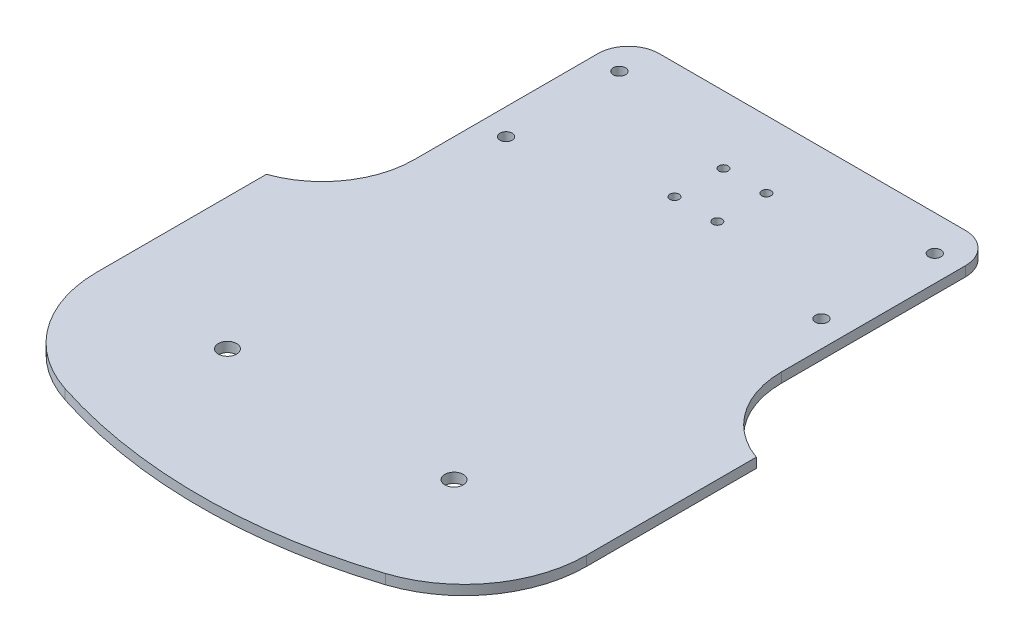
from build123d import *

# Parameters (mm, degrees)
P_IDAT_VYSUNUT_M1_DEPTH  = 0.8
SKICA2_R                 = 1
ODEBRAT_VYSUNUT_M1_DEPTH = 94.955095657
SKICA3_R                 = 0.75
ODEBRAT_VYSUNUT_M2_DEPTH = 94.955095657
SKICA8_R                 = 1.5
ODEBRAT_VYSUNUT_M4_DEPTH = 94.955095657


with BuildPart() as part:
    # Skica1 → Přidat vysunutím1 (new, symmetric)
    with BuildSketch(Plane(origin=(0, 0, 0), x_dir=(1, 0, 0), z_dir=(0, 1, 0))):
        with BuildLine():
            Line((-25, 15), (25, 15))
            ThreePointArc((25, 15), (28.535533906, 13.535533906), (30, 10))
            Line((30, 10), (30, -20))
            ThreePointArc((30, -20), (32.752551286, -28.660254038), (40, -34.142135624))
            Line((40, -34.142135624), (40, -61.846584384))
            ThreePointArc((40, -61.846584384), (36.172150801, -73.613552493), (26.153846154, -80.876302656))
            ThreePointArc((26.153846154, -80.876302656), (0, -85), (-26.153846154, -80.876302656))
            ThreePointArc((-26.153846154, -80.876302656), (-36.172150801, -73.613552493), (-40, -61.846584384))
            Line((-40, -61.846584384), (-40, -34.142135624))
            ThreePointArc((-40, -34.142135624), (-32.752551286, -28.660254038), (-30, -20))
            Line((-30, -20), (-30, 10))
            ThreePointArc((-30, 10), (-28.535533906, 13.535533906), (-25, 15))
        make_face()
    extrude(amount=P_IDAT_VYSUNUT_M1_DEPTH, both=True)

    # Skica2 → Odebrat vysunutím1 (cut, through all)
    with BuildSketch(Plane.XZ.offset(0.8)):
        with Locations((-25.75, -9.25)):
            Circle(SKICA2_R)
        with Locations((-25.75, 9.25)):
            Circle(SKICA2_R)
        with Locations((25.75, 9.25)):
            Circle(SKICA2_R)
        with Locations((25.75, -9.25)):
            Circle(SKICA2_R)
    extrude(amount=-ODEBRAT_VYSUNUT_M1_DEPTH, mode=Mode.SUBTRACT)

    # Skica3 → Odebrat vysunutím2 (cut, through all)
    with BuildSketch(Plane.XZ.offset(0.8)):
        with Locations((-3.5, 4)):
            Circle(SKICA3_R)
        with Locations((3.5, 4)):
            Circle(SKICA3_R)
        with Locations((-3.5, -4)):
            Circle(SKICA3_R)
        with Locations((3.5, -4)):
            Circle(SKICA3_R)
    extrude(amount=-ODEBRAT_VYSUNUT_M2_DEPTH, mode=Mode.SUBTRACT)

    # Skica8 → Odebrat vysunutím4 (cut, through all)
    with BuildSketch(Plane.XZ.offset(0.8)):
        with Locations((18.5, 62)):
            Circle(SKICA8_R)
        with Locations((-18.5, 62)):
            Circle(SKICA8_R)
    extrude(amount=-ODEBRAT_VYSUNUT_M4_DEPTH, mode=Mode.SUBTRACT)


solid = part.part
